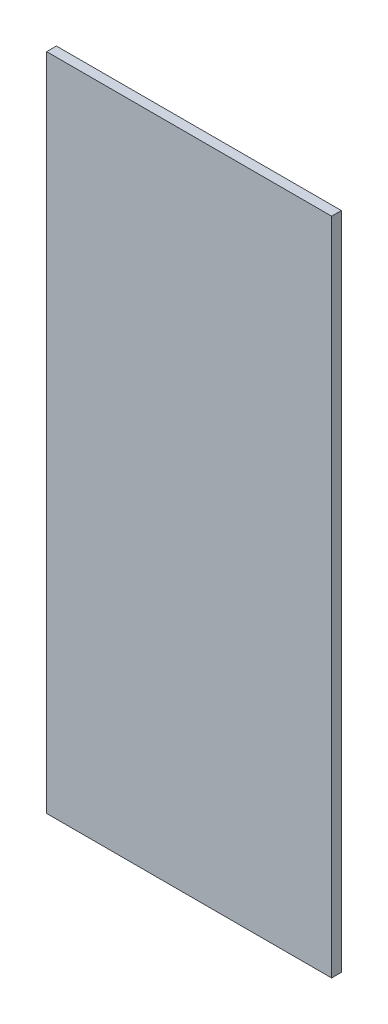
from build123d import *

# Parameters (mm, degrees)
SKETCH1_W           = 146
SKETCH1_H           = 338
BOSS_EXTRUDE1_DEPTH = 2.5


with BuildPart() as part:
    # Sketch1 → Boss-Extrude1 (new, symmetric)
    with BuildSketch(Plane.XY):
        Rectangle(SKETCH1_W, SKETCH1_H)
    extrude(amount=BOSS_EXTRUDE1_DEPTH, both=True)


solid = part.part
